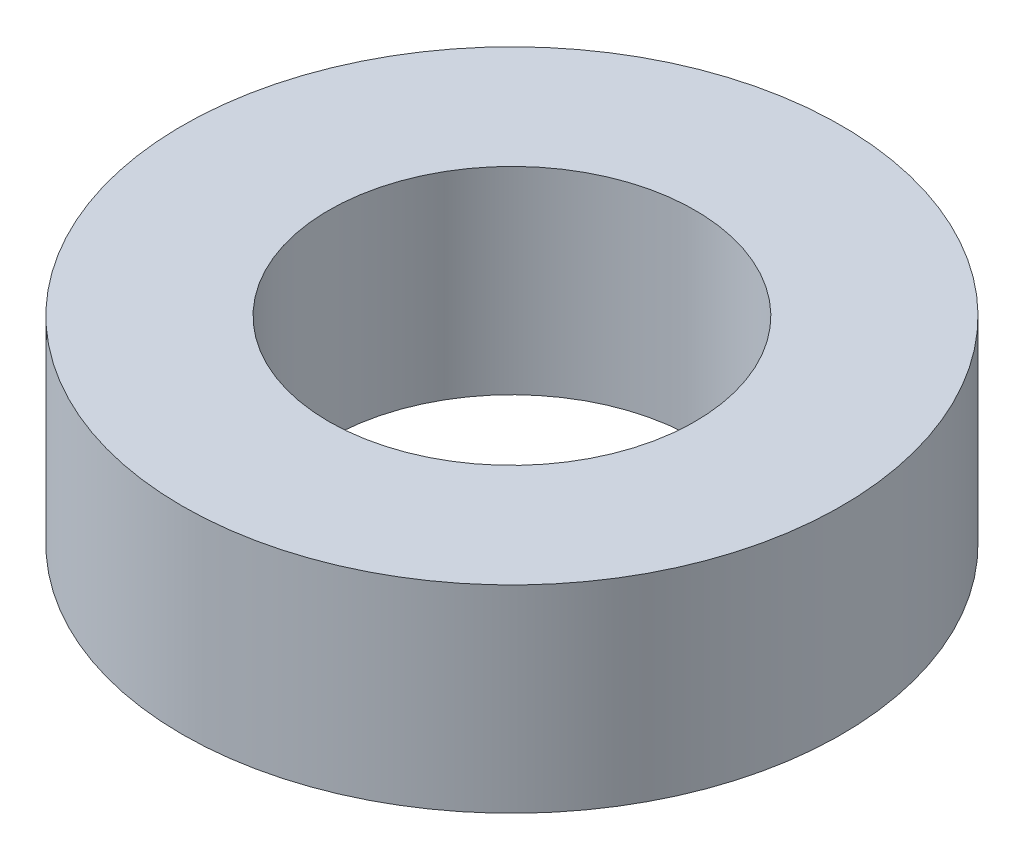
from build123d import *

# Parameters (mm, degrees)
SKETCH1_R           = 45
BOSS_EXTRUDE1_DEPTH = 27
SKETCH2_R           = 25
CUT_EXTRUDE1_DEPTH  = 70.130311731


with BuildPart() as part:
    # Sketch1 → Boss-Extrude1 (new body)
    with BuildSketch(Plane(origin=(0, 0, 0), x_dir=(1, 0, 0), z_dir=(0, 1, 0))):
        Circle(SKETCH1_R)
    extrude(amount=BOSS_EXTRUDE1_DEPTH)

    # Sketch2 → Cut-Extrude1 (cut, through all)
    with BuildSketch(Plane(origin=(0, 0, 0), x_dir=(1, 0, 0), z_dir=(0, 1, 0))):
        Circle(SKETCH2_R)
    extrude(amount=CUT_EXTRUDE1_DEPTH, mode=Mode.SUBTRACT)


solid = part.part
